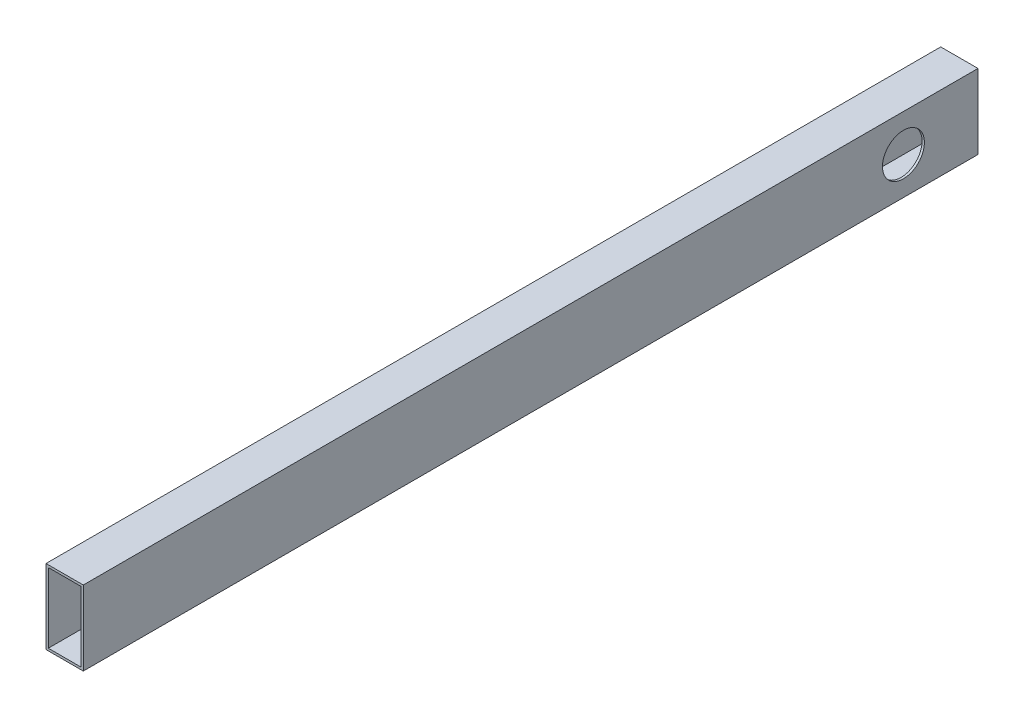
from build123d import *

# Parameters (mm, degrees)
SKETCH1_W           = 25.4
SKETCH1_H           = 50.8
SKETCH1_W_2         = 22.225
SKETCH1_H_2         = 47.625
BOSS_EXTRUDE1_DEPTH = 609.6
CUT_EXTRUDE1_REACH  = 614.24
SKETCH2_R           = 2.4892
SKETCH3_R           = 14.2875
CUT_EXTRUDE2_DEPTH  = 613.240116294


with BuildPart() as part:
    # Sketch1 → Boss-Extrude1 (new body)
    with BuildSketch(Plane.XY):
        with Locations((12.7, 25.4)):
            Rectangle(SKETCH1_W, SKETCH1_H)
        with Locations((12.7, 25.4)):
            Rectangle(SKETCH1_W_2, SKETCH1_H_2, mode=Mode.SUBTRACT)
    extrude(amount=BOSS_EXTRUDE1_DEPTH)

    # Sketch2 → Cut-Extrude1 (cut, up to next)
    with BuildSketch(Plane.ZY, mode=Mode.PRIVATE) as cut_extrude1_sk1:
        with Locations((558.8, 38.1)):
            Circle(SKETCH2_R)
    cut_extrude1_tool1 = extrude(cut_extrude1_sk1.sketch, amount=-CUT_EXTRUDE1_REACH, mode=Mode.PRIVATE) & part.part
    # Sketch2 → Cut-Extrude1 (cut, up to next)
    with BuildSketch(Plane.ZY, mode=Mode.PRIVATE) as cut_extrude1_sk2:
        with Locations((533.4, 38.1)):
            Circle(SKETCH2_R)
    cut_extrude1_tool2 = extrude(cut_extrude1_sk2.sketch, amount=-CUT_EXTRUDE1_REACH, mode=Mode.PRIVATE) & part.part
    # Sketch2 → Cut-Extrude1 (cut, up to next)
    with BuildSketch(Plane.ZY, mode=Mode.PRIVATE) as cut_extrude1_sk3:
        with Locations((508, 38.1)):
            Circle(SKETCH2_R)
    cut_extrude1_tool3 = extrude(cut_extrude1_sk3.sketch, amount=-CUT_EXTRUDE1_REACH, mode=Mode.PRIVATE) & part.part
    # Sketch2 → Cut-Extrude1 (cut, up to next)
    with BuildSketch(Plane.ZY, mode=Mode.PRIVATE) as cut_extrude1_sk4:
        with Locations((482.6, 38.1)):
            Circle(SKETCH2_R)
    cut_extrude1_tool4 = extrude(cut_extrude1_sk4.sketch, amount=-CUT_EXTRUDE1_REACH, mode=Mode.PRIVATE) & part.part
    # Sketch2 → Cut-Extrude1 (cut, up to next)
    with BuildSketch(Plane.ZY, mode=Mode.PRIVATE) as cut_extrude1_sk5:
        with Locations((558.8, 12.7)):
            Circle(SKETCH2_R)
    cut_extrude1_tool5 = extrude(cut_extrude1_sk5.sketch, amount=-CUT_EXTRUDE1_REACH, mode=Mode.PRIVATE) & part.part
    # Sketch2 → Cut-Extrude1 (cut, up to next)
    with BuildSketch(Plane.ZY, mode=Mode.PRIVATE) as cut_extrude1_sk6:
        with Locations((533.4, 12.7)):
            Circle(SKETCH2_R)
    cut_extrude1_tool6 = extrude(cut_extrude1_sk6.sketch, amount=-CUT_EXTRUDE1_REACH, mode=Mode.PRIVATE) & part.part
    # Sketch2 → Cut-Extrude1 (cut, up to next)
    with BuildSketch(Plane.ZY, mode=Mode.PRIVATE) as cut_extrude1_sk7:
        with Locations((508, 12.7)):
            Circle(SKETCH2_R)
    cut_extrude1_tool7 = extrude(cut_extrude1_sk7.sketch, amount=-CUT_EXTRUDE1_REACH, mode=Mode.PRIVATE) & part.part
    # Sketch2 → Cut-Extrude1 (cut, up to next)
    with BuildSketch(Plane.ZY, mode=Mode.PRIVATE) as cut_extrude1_sk8:
        with Locations((482.6, 12.7)):
            Circle(SKETCH2_R)
    cut_extrude1_tool8 = extrude(cut_extrude1_sk8.sketch, amount=-CUT_EXTRUDE1_REACH, mode=Mode.PRIVATE) & part.part
    # Sketch2 → Cut-Extrude1 (cut, up to next)
    with BuildSketch(Plane.ZY, mode=Mode.PRIVATE) as cut_extrude1_sk9:
        with Locations((584.2, 12.7)):
            Circle(SKETCH2_R)
    cut_extrude1_tool9 = extrude(cut_extrude1_sk9.sketch, amount=-CUT_EXTRUDE1_REACH, mode=Mode.PRIVATE) & part.part
    # Sketch2 → Cut-Extrude1 (cut, up to next)
    with BuildSketch(Plane.ZY, mode=Mode.PRIVATE) as cut_extrude1_sk10:
        with Locations((584.2, 38.1)):
            Circle(SKETCH2_R)
    cut_extrude1_tool10 = extrude(cut_extrude1_sk10.sketch, amount=-CUT_EXTRUDE1_REACH, mode=Mode.PRIVATE) & part.part
    add(cut_extrude1_tool1.solids().sort_by_distance((0, 38.1, 558.8))[0], mode=Mode.SUBTRACT)
    add(cut_extrude1_tool2.solids().sort_by_distance((0, 38.1, 533.4))[0], mode=Mode.SUBTRACT)
    add(cut_extrude1_tool3.solids().sort_by_distance((0, 38.1, 508))[0], mode=Mode.SUBTRACT)
    add(cut_extrude1_tool4.solids().sort_by_distance((0, 38.1, 482.6))[0], mode=Mode.SUBTRACT)
    add(cut_extrude1_tool5.solids().sort_by_distance((0, 12.7, 558.8))[0], mode=Mode.SUBTRACT)
    add(cut_extrude1_tool6.solids().sort_by_distance((0, 12.7, 533.4))[0], mode=Mode.SUBTRACT)
    add(cut_extrude1_tool7.solids().sort_by_distance((0, 12.7, 508))[0], mode=Mode.SUBTRACT)
    add(cut_extrude1_tool8.solids().sort_by_distance((0, 12.7, 482.6))[0], mode=Mode.SUBTRACT)
    add(cut_extrude1_tool9.solids().sort_by_distance((0, 12.7, 584.2))[0], mode=Mode.SUBTRACT)
    add(cut_extrude1_tool10.solids().sort_by_distance((0, 38.1, 584.2))[0], mode=Mode.SUBTRACT)

    # Sketch3 → Cut-Extrude2 (cut, through all)
    with BuildSketch(Plane.ZY):
        with Locations((50.8, 25.4)):
            Circle(SKETCH3_R)
    extrude(amount=-CUT_EXTRUDE2_DEPTH, mode=Mode.SUBTRACT)


solid = part.part
